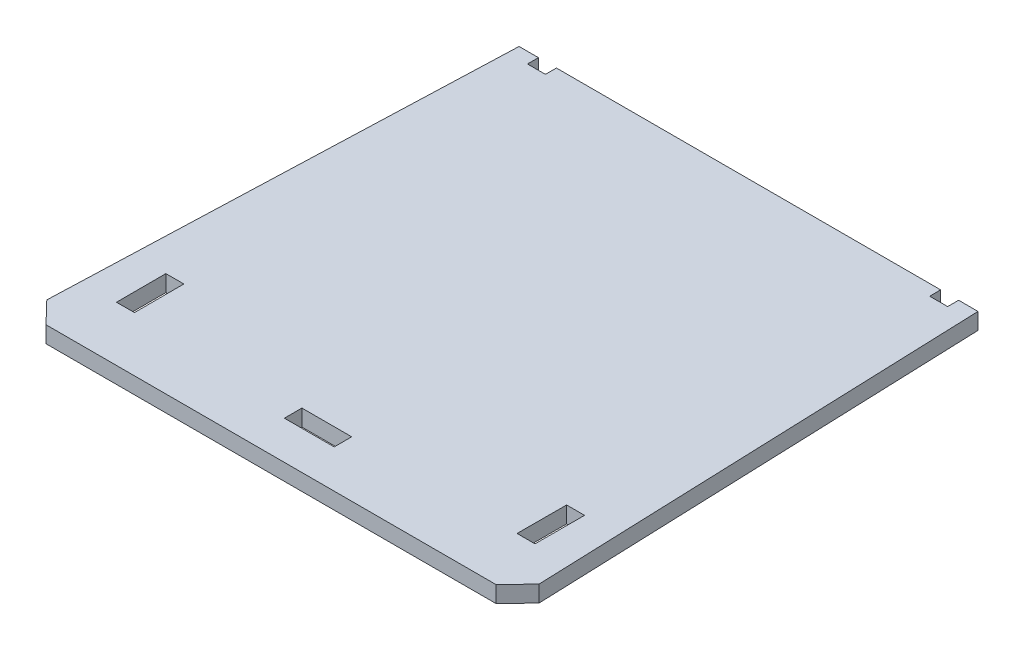
from build123d import *

# Parameters (mm, degrees)
BOSS_EXTRUDE1_DEPTH = 15
CUT_EXTRUDE1_DEPTH  = 469.027776953
SKETCH4_W           = 45.375817112
SKETCH4_H           = 15.979474245
CUT_EXTRUDE5_DEPTH  = 469.027776953
CUT_EXTRUDE6_DEPTH  = 469.027776953


with BuildPart() as part:
    # Sketch1 → Boss-Extrude1 (new body)
    with BuildSketch(Plane(origin=(0, 0, 0), x_dir=(1, 0, 0), z_dir=(0, 1, 0))):
        Polygon((-191.430851466, 25.01019046), (-191.430851466, 15.01019046), (-175.061614118, 15.01019046), (-175.061614118, 25.01019046), (175.061614118, 25.01019046), (175.061614118, 15.01019046), (191.430851466, 15.01019046), (191.430851466, 25.01019046), (209.085265072, 25.01019046), (225, -410.121933088), (-225, -410.121933088), (-209.085265072, 25.01019046), align=None)
    extrude(amount=-BOSS_EXTRUDE1_DEPTH)

    # Sketch2 → Cut-Extrude1 (cut, through all)
    with BuildSketch(Plane.XZ.offset(15)):
        Polygon((190.662364216, 360.244932401), (190.758526229, 315.166919875), (174.389363372, 315.132000597), (174.293201359, 360.210013123), align=None)
    cut_extrude1 = extrude(amount=-CUT_EXTRUDE1_DEPTH, mode=Mode.SUBTRACT)

    # Mirror1: Cut-Extrude1 across plane
    add(cut_extrude1.mirror(Plane(origin=(0, 0, 0), x_dir=(0, 0, 1), z_dir=(1, 0, 0))), mode=Mode.SUBTRACT)

    # Sketch4 → Cut-Extrude5 (cut, through all)
    with BuildSketch(Plane(origin=(0, 0, 0), x_dir=(1, 0, 0), z_dir=(0, 1, 0))):
        with Locations((0, -367.255161149)):
            Rectangle(SKETCH4_W, SKETCH4_H)
    extrude(amount=-CUT_EXTRUDE5_DEPTH, mode=Mode.SUBTRACT)

    # Sketch6 → Cut-Extrude6 (cut, through all)
    with BuildSketch(Plane(origin=(0, 0, 0), x_dir=(1, 0, 0), z_dir=(0, 1, 0))):
        Polygon((224.268998991, -390.135296615), (205, -410.121933088), (225, -410.121933088), align=None)
        Polygon((-205, -410.121933088), (-225, -410.121933088), (-224.268998991, -390.135296615), align=None)
    extrude(amount=-CUT_EXTRUDE6_DEPTH, mode=Mode.SUBTRACT)


solid = part.part
